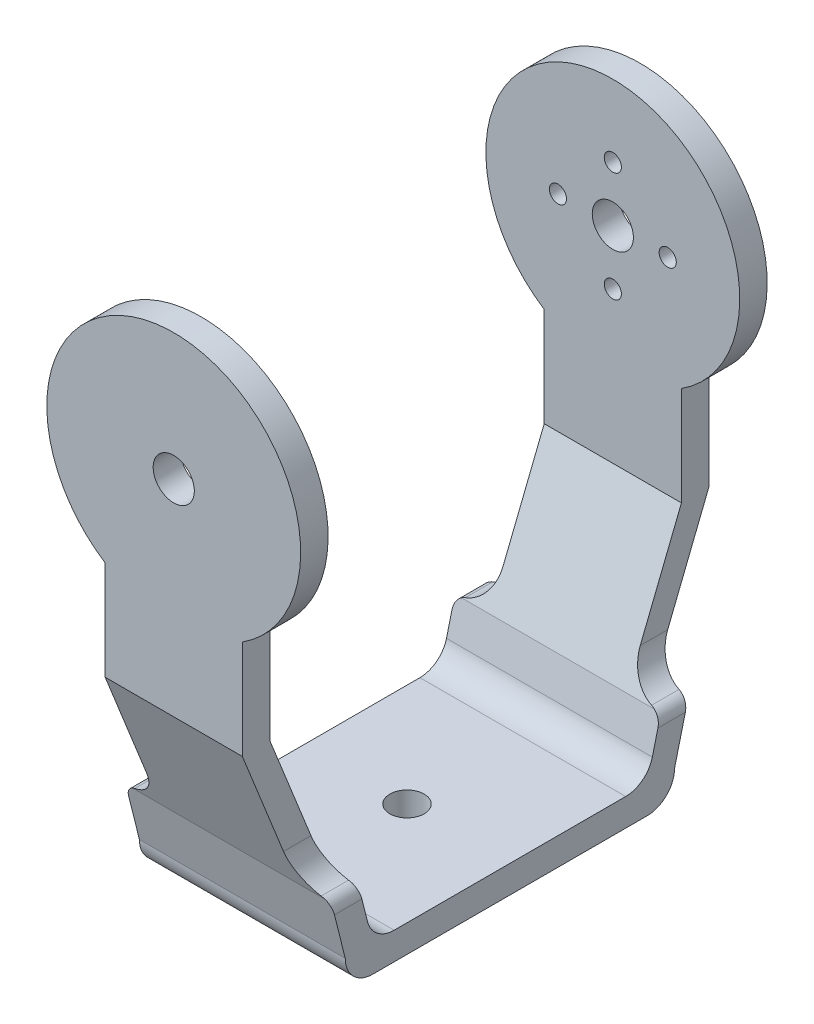
from build123d import *

# Parameters (mm, degrees)
EXTRUDE_1_DEPTH        = 4
EXTRUDE_2_DEPTH        = 10
EXTRUDE_3_DEPTH        = 15
FILLET_1_R             = 5
FILLET_2_R             = 5
SKETCH_4_W             = 30
SKETCH_4_H             = 24
EXTRUDE_4_DEPTH        = 4
FILLET_3_R             = 4
FILLET_4_R             = 4
FILLET_5_R             = 2
FILLET_6_R             = 2
MIRROR_START           = -15
MIRROR_7_DEPTH         = 30
MIRROR_10_COPY_1_DEPTH = 4
MIRROR_10_COPY_2_DEPTH = 10
MIRROR_10_COPY_3_DEPTH = 4
MIRROR_10_COPY_4_DEPTH = 10
FILLET_7_R             = 4
FILLET_8_R             = 5
FILLET_9_R             = 2
SKETCH_5_R             = 2.5
CUT_EXTRUDE_1_DEPTH    = 10
SKETCH_6_R             = 3
CUT_EXTRUDE_2_DEPTH    = 94.862931981
SKETCH_7_R             = 1.25
CUT_EXTRUDE_3_DEPTH    = 10


# Read off the part's stored shape, not the designer's step: 镜向7
# Some blends are built 0.0001 mm under size
with BuildPart() as part:
    # 草图1 → 凸台-拉伸1 (new body)
    with BuildSketch(Plane.XY.offset(30)):
        with BuildLine():
            Line((-10, -15.564382416), (-10, -30))
            Line((-10, -30), (10, -30))
            Line((10, -30), (10, -15.564382416))
            ThreePointArc((10, -15.564382416), (0, 18.5), (-10, -15.564382416))
        make_face()
    extrude_1 = extrude(amount=EXTRUDE_1_DEPTH)

    # 草图2 → 凸台-拉伸2 (add, symmetric)
    with BuildSketch(Plane(origin=(0, 0, 0), x_dir=(0, 0, -1), z_dir=(1, 0, 0))):
        Polygon((-30, -30), (-34, -30), (-26, -50), (-22, -50), align=None)
    extrude_2 = extrude(amount=EXTRUDE_2_DEPTH, both=True)

    # 草图3 → 凸台-拉伸3 (add, symmetric)
    with BuildSketch(Plane(origin=(0, 0, 0), x_dir=(0, 0, -1), z_dir=(1, 0, 0))):
        Polygon((-22, -50), (-26, -50), (-24, -58), (-20, -58), align=None)
    extrude(amount=EXTRUDE_3_DEPTH, both=True)

    # 圆角1
    # the kernel refuses this fillet: 5 mm, written as the material it adds along each edge
    with BuildSketch(Plane(origin=(-10, -50, 38.5), x_dir=(-1, 0, 0), z_dir=(0, 0, -1))) as fillet_1_piece_1_section:
        with BuildLine():
            CenterArc((FILLET_1_R, FILLET_1_R), FILLET_1_R, 180, 90)
            Line((0, FILLET_1_R), (0, 0))
            Line((0, 0), (FILLET_1_R, 0))
        make_face()
    fillet_1_piece_1 = extrude(amount=29, mode=Mode.PRIVATE)
    fillet_1_piece_1 = split(fillet_1_piece_1, bisect_by=Plane(origin=(-10.532362598, -47.811458148, 26.547135463), z_dir=(0, -0.24253562503633297, 0.9701425001453319)), keep=Keep.TOP, mode=Mode.PRIVATE)
    fillet_1_piece_1 = split(fillet_1_piece_1, bisect_by=Plane(origin=(-10.532362598, -47.905028454, 26.837988618), z_dir=(0, 0.3713906763541037, -0.9284766908852594)), keep=Keep.TOP, mode=Mode.PRIVATE)
    add(fillet_1_piece_1)
    with BuildSketch(Plane(origin=(-10, -50, 38.5), x_dir=(-1, 0, 0), z_dir=(0, 0, -1))) as fillet_1_piece_2_section:
        with BuildLine():
            CenterArc((FILLET_1_R, FILLET_1_R), FILLET_1_R, 180, 90)
            Line((0, FILLET_1_R), (0, 0))
            Line((0, 0), (FILLET_1_R, 0))
        make_face()
    fillet_1_piece_2 = extrude(amount=29, mode=Mode.PRIVATE)
    fillet_1_piece_2 = split(fillet_1_piece_2, bisect_by=Plane(origin=(-11.158452705, -48.423398816, 22.394150296), z_dir=(0, -0.2425356250363334, 0.9701425001453319)), keep=Keep.TOP, mode=Mode.PRIVATE)
    fillet_1_piece_2 = split(fillet_1_piece_2, bisect_by=Plane(origin=(-11.158452705, -49.364575286, 26.158856178), z_dir=(0, 0.24253562503633297, -0.9701425001453319)), keep=Keep.TOP, mode=Mode.PRIVATE)
    fillet_1_piece_2 = split(fillet_1_piece_2, bisect_by=Plane(origin=(-11.158452705, -49.630929403, 26.147628239), z_dir=(0, 0.3713906763541037, -0.9284766908852594)), keep=Keep.TOP, mode=Mode.PRIVATE)
    fillet_1_piece_2 = split(fillet_1_piece_2, bisect_by=Plane(origin=(-11.158452705, -48.251619058, 22.699352377), z_dir=(0, -0.3713906763541037, 0.9284766908852594)), keep=Keep.TOP, mode=Mode.PRIVATE)
    add(fillet_1_piece_2)

    # 圆角2
    # the kernel refuses this fillet: 5 mm, written as the material it adds along each edge
    with BuildSketch(Plane(origin=(10, -50, 38.5), x_dir=(0, 1, 0), z_dir=(0, 0, -1))) as fillet_2_piece_1_section:
        with BuildLine():
            CenterArc((FILLET_2_R, FILLET_2_R), FILLET_2_R, 180, 90)
            Line((0, FILLET_2_R), (0, 0))
            Line((0, 0), (FILLET_2_R, 0))
        make_face()
    fillet_2_piece_1 = extrude(amount=29, mode=Mode.PRIVATE)
    fillet_2_piece_1 = split(fillet_2_piece_1, bisect_by=Plane(origin=(10.532362598, -47.905028454, 26.837988618), z_dir=(0, 0.3713906763541038, -0.9284766908852593)), keep=Keep.TOP, mode=Mode.PRIVATE)
    fillet_2_piece_1 = split(fillet_2_piece_1, bisect_by=Plane(origin=(10.532362598, -47.811458148, 26.547135463), z_dir=(0, -0.24253562503633297, 0.9701425001453319)), keep=Keep.TOP, mode=Mode.PRIVATE)
    add(fillet_2_piece_1)
    with BuildSketch(Plane(origin=(10, -50, 38.5), x_dir=(0, 1, 0), z_dir=(0, 0, -1))) as fillet_2_piece_2_section:
        with BuildLine():
            CenterArc((FILLET_2_R, FILLET_2_R), FILLET_2_R, 180, 90)
            Line((0, FILLET_2_R), (0, 0))
            Line((0, 0), (FILLET_2_R, 0))
        make_face()
    fillet_2_piece_2 = extrude(amount=29, mode=Mode.PRIVATE)
    fillet_2_piece_2 = split(fillet_2_piece_2, bisect_by=Plane(origin=(11.158452705, -48.251619058, 22.699352377), z_dir=(0, -0.3713906763541038, 0.9284766908852593)), keep=Keep.TOP, mode=Mode.PRIVATE)
    fillet_2_piece_2 = split(fillet_2_piece_2, bisect_by=Plane(origin=(11.158452705, -49.630929403, 26.147628239), z_dir=(0, 0.3713906763541038, -0.9284766908852593)), keep=Keep.TOP, mode=Mode.PRIVATE)
    fillet_2_piece_2 = split(fillet_2_piece_2, bisect_by=Plane(origin=(11.158452705, -48.423398816, 22.394150296), z_dir=(0, -0.2425356250363334, 0.9701425001453319)), keep=Keep.TOP, mode=Mode.PRIVATE)
    fillet_2_piece_2 = split(fillet_2_piece_2, bisect_by=Plane(origin=(11.158452705, -49.364575286, 26.158856178), z_dir=(0, 0.24253562503633297, -0.9701425001453319)), keep=Keep.TOP, mode=Mode.PRIVATE)
    add(fillet_2_piece_2)

    # 草图4 → 凸台-拉伸4 (add)
    with BuildSketch(Plane.XZ.offset(58)):
        with Locations((0, 12)):
            Rectangle(SKETCH_4_W, SKETCH_4_H)
    extrude_4 = extrude(amount=EXTRUDE_4_DEPTH)

    # 圆角3
    fillet_3_edges = [part.edges().sort_by_distance(p)[0] for p in [
        (0, -62, 24),
    ]]
    fillet(fillet_3_edges, radius=FILLET_3_R - 0.0001)  # a hair under: the kernel refuses the full size

    # 圆角4
    fillet_4_edges = [part.edges().sort_by_distance(p)[0] for p in [
        (0, -58, 20),
    ]]
    fillet(fillet_4_edges, radius=FILLET_4_R)

    # 圆角5
    fillet_5_edges = [part.edges().sort_by_distance(p)[0] for p in [
        (-15, -50, 24),
    ]]
    fillet(fillet_5_edges, radius=FILLET_5_R)

    # 圆角6
    fillet_6_edges = [part.edges().sort_by_distance(p)[0] for p in [
        (15, -50, 24),
    ]]
    fillet(fillet_6_edges, radius=FILLET_6_R)

    # 镜向6: 凸台-拉伸4 across plane
    add(extrude_4.mirror(Plane.XY))

    # 镜向7 outline → 镜向7 (add)
    with BuildSketch(Plane.YZ.offset(MIRROR_START)):
        with BuildLine():
            Line((-50, -22), (-54.9701425, -20.757464375))
            ThreePointArc((-54.9701425, -20.757464375), (-57.152821752, -19.338543212), (-58, -16.876894374))
            Line((-58, -16.876894374), (-58, -24))
            Line((-58, -24), (-50, -26))
            Line((-50, -26), (-50, -22))
        make_face()
    extrude(amount=MIRROR_7_DEPTH)

    # 镜向10 copy 1 sketch → 镜向10 copy 1 (add)
    with BuildSketch(Plane.XY.offset(30)):
        with BuildLine():
            Line((-10, -15.564382416), (-10, -30))
            Line((-10, -30), (10, -30))
            Line((10, -30), (10, -15.564382416))
            ThreePointArc((10, -15.564382416), (0, 18.5), (-10, -15.564382416))
        make_face()
    extrude(amount=MIRROR_10_COPY_1_DEPTH)

    # 镜向10 copy 2 sketch → 镜向10 copy 2 (add, symmetric)
    with BuildSketch(Plane(origin=(0, 0, 0), x_dir=(0, 0, -1), z_dir=(1, 0, 0))):
        Polygon((-30, -30), (-34, -30), (-26, -50), (-22, -50), align=None)
    extrude(amount=MIRROR_10_COPY_2_DEPTH, both=True)



with BuildPart() as mirror_9_1:
    # 镜向9: 凸台-拉伸1, 凸台-拉伸2 across plane
    add(extrude_1.mirror(Plane.XY))
    add(extrude_2.mirror(Plane.XY))

    # 镜向10 copy 3 sketch → 镜向10 copy 3 (add)
    with BuildSketch(Plane(origin=(0, 0, -30), x_dir=(1, 0, 0), z_dir=(0, 0, -1))):
        with BuildLine():
            Line((-10, 15.564382416), (-10, 30))
            Line((-10, 30), (10, 30))
            Line((10, 30), (10, 15.564382416))
            ThreePointArc((10, 15.564382416), (0, -18.5), (-10, 15.564382416))
        make_face()
    extrude(amount=MIRROR_10_COPY_3_DEPTH)


with BuildPart() as part_1:
    add(part.part)

    add(mirror_9_1.part)  # 镜向10 copy 4 merges 镜向9_1
    # 镜向10 copy 4 sketch → 镜向10 copy 4 (add, symmetric)
    with BuildSketch(Plane(origin=(0, 0, 0), x_dir=(0, 0, 1), z_dir=(1, 0, 0))):
        Polygon((-30, 30), (-34, 30), (-26, 50), (-22, 50), align=None)
    extrude(amount=MIRROR_10_COPY_4_DEPTH, both=True)

    # 圆角7
    fillet_7_edges = [part_1.edges().sort_by_distance(p)[0] for p in [
        (0, -62, -24),
    ]]
    fillet(fillet_7_edges, radius=FILLET_7_R - 0.0001)  # a hair under: the kernel refuses the full size

    # 圆角8
    # the kernel refuses this fillet: 5 mm, written as the material it adds along each edge
    with BuildSketch(Plane(origin=(10, -50, -38.5), x_dir=(1, 0, 0), z_dir=(0, 0, 1))) as fillet_8_piece_1_section:
        with BuildLine():
            CenterArc((FILLET_8_R, FILLET_8_R), FILLET_8_R, 180, 90)
            Line((0, FILLET_8_R), (0, 0))
            Line((0, 0), (FILLET_8_R, 0))
        make_face()
    fillet_8_piece_1 = extrude(amount=29, mode=Mode.PRIVATE)
    fillet_8_piece_1 = split(fillet_8_piece_1, bisect_by=Plane(origin=(10.532362598, -47.811458148, -26.547135463), z_dir=(0, -0.24253562503633297, -0.9701425001453319)), keep=Keep.TOP, mode=Mode.PRIVATE)
    fillet_8_piece_1 = split(fillet_8_piece_1, bisect_by=Plane(origin=(10.532362598, -47.905028454, -26.837988618), z_dir=(0, 0.3713906763541037, 0.9284766908852594)), keep=Keep.TOP, mode=Mode.PRIVATE)
    add(fillet_8_piece_1)
    with BuildSketch(Plane(origin=(10, -50, -38.5), x_dir=(1, 0, 0), z_dir=(0, 0, 1))) as fillet_8_piece_2_section:
        with BuildLine():
            CenterArc((FILLET_8_R, FILLET_8_R), FILLET_8_R, 180, 90)
            Line((0, FILLET_8_R), (0, 0))
            Line((0, 0), (FILLET_8_R, 0))
        make_face()
    fillet_8_piece_2 = extrude(amount=29, mode=Mode.PRIVATE)
    fillet_8_piece_2 = split(fillet_8_piece_2, bisect_by=Plane(origin=(11.158452705, -49.364575286, -26.158856178), z_dir=(0, 0.24253562503633297, 0.9701425001453319)), keep=Keep.TOP, mode=Mode.PRIVATE)
    fillet_8_piece_2 = split(fillet_8_piece_2, bisect_by=Plane(origin=(11.158452705, -48.423398816, -22.394150296), z_dir=(0, -0.24253562503633266, -0.970142500145332)), keep=Keep.TOP, mode=Mode.PRIVATE)
    fillet_8_piece_2 = split(fillet_8_piece_2, bisect_by=Plane(origin=(11.158452705, -49.630929403, -26.147628239), z_dir=(0, 0.3713906763541037, 0.9284766908852594)), keep=Keep.TOP, mode=Mode.PRIVATE)
    fillet_8_piece_2 = split(fillet_8_piece_2, bisect_by=Plane(origin=(11.158452705, -48.251619058, -22.699352377), z_dir=(0, -0.3713906763541037, -0.9284766908852594)), keep=Keep.TOP, mode=Mode.PRIVATE)
    add(fillet_8_piece_2)
    with BuildSketch(Plane(origin=(-10, -50, -38.5), x_dir=(-1, 0, 0), z_dir=(0, 0, 1))) as fillet_8_piece_3_section:
        with BuildLine():
            CenterArc((FILLET_8_R, -FILLET_8_R), FILLET_8_R, 90, 90)
            Line((0, -FILLET_8_R), (0, 0))
            Line((0, 0), (FILLET_8_R, 0))
        make_face()
    fillet_8_piece_3 = extrude(amount=29, mode=Mode.PRIVATE)
    fillet_8_piece_3 = split(fillet_8_piece_3, bisect_by=Plane(origin=(-10.532362598, -47.811458148, -26.547135463), z_dir=(0, -0.24253562503633297, -0.9701425001453319)), keep=Keep.TOP, mode=Mode.PRIVATE)
    fillet_8_piece_3 = split(fillet_8_piece_3, bisect_by=Plane(origin=(-10.532362598, -47.905028454, -26.837988618), z_dir=(0, 0.3713906763541037, 0.9284766908852594)), keep=Keep.TOP, mode=Mode.PRIVATE)
    add(fillet_8_piece_3)
    with BuildSketch(Plane(origin=(-10, -50, -38.5), x_dir=(-1, 0, 0), z_dir=(0, 0, 1))) as fillet_8_piece_4_section:
        with BuildLine():
            CenterArc((FILLET_8_R, -FILLET_8_R), FILLET_8_R, 90, 90)
            Line((0, -FILLET_8_R), (0, 0))
            Line((0, 0), (FILLET_8_R, 0))
        make_face()
    fillet_8_piece_4 = extrude(amount=29, mode=Mode.PRIVATE)
    fillet_8_piece_4 = split(fillet_8_piece_4, bisect_by=Plane(origin=(-11.158452705, -49.364575286, -26.158856178), z_dir=(0, 0.24253562503633297, 0.9701425001453319)), keep=Keep.TOP, mode=Mode.PRIVATE)
    fillet_8_piece_4 = split(fillet_8_piece_4, bisect_by=Plane(origin=(-11.158452705, -48.423398816, -22.394150296), z_dir=(0, -0.24253562503633266, -0.970142500145332)), keep=Keep.TOP, mode=Mode.PRIVATE)
    fillet_8_piece_4 = split(fillet_8_piece_4, bisect_by=Plane(origin=(-11.158452705, -49.630929403, -26.147628239), z_dir=(0, 0.3713906763541037, 0.9284766908852594)), keep=Keep.TOP, mode=Mode.PRIVATE)
    fillet_8_piece_4 = split(fillet_8_piece_4, bisect_by=Plane(origin=(-11.158452705, -48.251619058, -22.699352377), z_dir=(0, -0.3713906763541037, -0.9284766908852594)), keep=Keep.TOP, mode=Mode.PRIVATE)
    add(fillet_8_piece_4)

    # 圆角9
    fillet_9_edges = [part_1.edges().sort_by_distance(p)[0] for p in [
        (15, -50, -24),
        (-15, -50, -24),
    ]]
    fillet(fillet_9_edges, radius=FILLET_9_R)

    # 草图5 → 切除-拉伸1 (cut)
    with BuildSketch(Plane.XZ.offset(62)):
        with Locations(Location((0, 0, 0), (0, 0, 270))):
            Circle(SKETCH_5_R)
    extrude(amount=-CUT_EXTRUDE_1_DEPTH, mode=Mode.SUBTRACT)

    # 草图6 → 切除-拉伸2 (cut, through all)
    with BuildSketch(Plane(origin=(0, 0, -34), x_dir=(-1, 0, 0), z_dir=(0, 0, -1))):
        Circle(SKETCH_6_R)
    extrude(amount=-CUT_EXTRUDE_2_DEPTH, mode=Mode.SUBTRACT)

    # 草图7 → 切除-拉伸3 (cut)
    with BuildSketch(Plane(origin=(0, 0, -34), x_dir=(-1, 0, 0), z_dir=(0, 0, -1))):
        with Locations((0, 8)):
            Circle(SKETCH_7_R)
        with Locations((8, 0)):
            Circle(SKETCH_7_R)
        with Locations((0, -8)):
            Circle(SKETCH_7_R)
        with Locations((-8, 0)):
            Circle(SKETCH_7_R)
    extrude(amount=-CUT_EXTRUDE_3_DEPTH, mode=Mode.SUBTRACT)


solid = part_1.part
